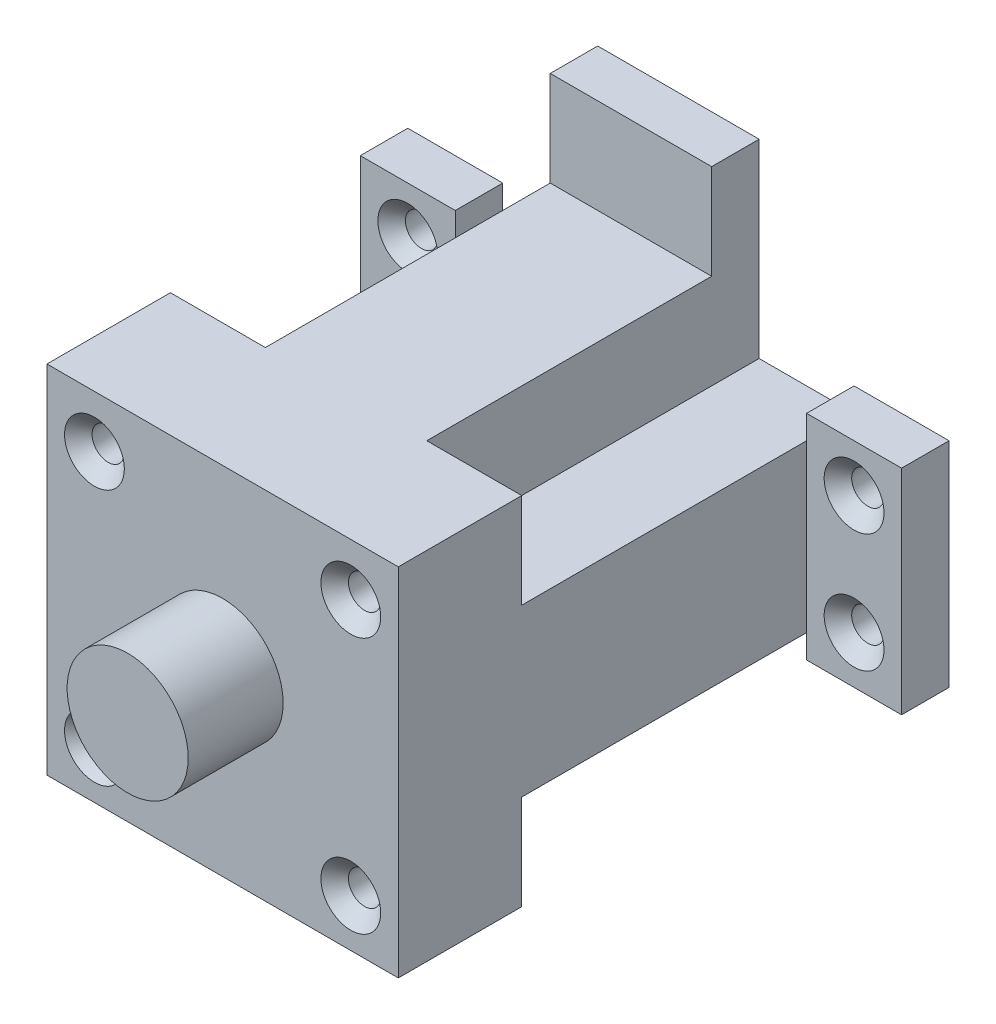
from build123d import *

# Parameters (mm, degrees)
ESQUISSE1_W                                       = 37
ESQUISSE1_H                                       = 37.5
BOSS_EXTRU_1_DEPTH                                = 48
ESQUISSE2_R                                       = 6.375
BOSS_EXTRU_2_DEPTH                                = 10
FRAISAGE_POUR_VIS_T_TE_FRAIS_E_BOMB_E_D           = 3.4
FRAISAGE_POUR_VIS_T_TE_FRAIS_E_BOMB_E_DEPTH       = 48
FRAISAGE_POUR_VIS_T_TE_FRAIS_E_BOMB_E_CSINK_D     = 6.3
FRAISAGE_POUR_VIS_T_TE_FRAIS_E_BOMB_E_CSINK_ANGLE = 90
FRAISAGE_POUR_VIS_T_TE_FRAIS_E_BOMB_E_TIP         = 1.021463052
ESQUISSE10_W                                      = 10
ESQUISSE10_H                                      = 10
ENL_V_MAT_EXTRU_1_DEPTH                           = 35
ESQUISSE11_W                                      = 17
ESQUISSE11_H                                      = 10
ESQUISSE11_W_2                                    = 10
ESQUISSE11_H_2                                    = 22.5
BOSS_EXTRU_5_DEPTH                                = 5
FRAISAGE_POUR_VIS_T_TE_FRAIS_E_BOM_2_D            = 3.4
FRAISAGE_POUR_VIS_T_TE_FRAIS_E_BOM_2_DEPTH        = 5
FRAISAGE_POUR_VIS_T_TE_FRAIS_E_BOM_2_CSINK_D      = 6.3
FRAISAGE_POUR_VIS_T_TE_FRAIS_E_BOM_2_CSINK_ANGLE  = 90
FRAISAGE_POUR_VIS_T_TE_FRAIS_E_BOM_2_TIP          = 1.021463052


with BuildPart() as part:
    # Esquisse1 → Boss.-Extru.1 (new body)
    with BuildSketch(Plane.XY):
        with Locations((18.5, 18.75)):
            Rectangle(ESQUISSE1_W, ESQUISSE1_H)
    extrude(amount=BOSS_EXTRU_1_DEPTH)

    # Esquisse2 → Boss.-Extru.2 (add)
    with BuildSketch(Plane.XY.offset(48)):
        with Locations((18.5, 19)):
            Circle(ESQUISSE2_R)
    extrude(amount=BOSS_EXTRU_2_DEPTH)

    # Fraisage pour vis _ t_te frais_e bomb_e
    with Locations(Plane.XY.offset(48)):
        with Locations((5, 32), (32, 32), (32, 5), (5, 5)):
            CounterSinkHole(FRAISAGE_POUR_VIS_T_TE_FRAIS_E_BOMB_E_D / 2, FRAISAGE_POUR_VIS_T_TE_FRAIS_E_BOMB_E_CSINK_D / 2, depth=FRAISAGE_POUR_VIS_T_TE_FRAIS_E_BOMB_E_DEPTH, counter_sink_angle=FRAISAGE_POUR_VIS_T_TE_FRAIS_E_BOMB_E_CSINK_ANGLE)
            with Locations((0, 0, -(FRAISAGE_POUR_VIS_T_TE_FRAIS_E_BOMB_E_DEPTH + FRAISAGE_POUR_VIS_T_TE_FRAIS_E_BOMB_E_TIP / 2))):  # 118° drill point
                Cone(0, FRAISAGE_POUR_VIS_T_TE_FRAIS_E_BOMB_E_D / 2, FRAISAGE_POUR_VIS_T_TE_FRAIS_E_BOMB_E_TIP, mode=Mode.SUBTRACT)

    # Esquisse10 → Enlèv. mat.-Extru.1 (cut)
    with BuildSketch(Plane(origin=(0, 0, 0), x_dir=(-1, 0, 0), z_dir=(0, 0, -1))):
        with Locations((-32, 5)):
            Rectangle(ESQUISSE10_W, ESQUISSE10_H)
        with Locations((-32, 32.5)):
            Rectangle(ESQUISSE10_W, ESQUISSE10_H)
        with Locations((-5, 32.5)):
            Rectangle(ESQUISSE10_W, ESQUISSE10_H)
        with Locations((-5, 5)):
            Rectangle(ESQUISSE10_W, ESQUISSE10_H)
    extrude(amount=-ENL_V_MAT_EXTRU_1_DEPTH, mode=Mode.SUBTRACT)

    # Esquisse11 → Boss.-Extru.5 (add)
    with BuildSketch(Plane(origin=(0, 0, 0), x_dir=(-1, 0, 0), z_dir=(0, 0, -1))):
        with Locations((-18.5, 42.5)):
            Rectangle(ESQUISSE11_W, ESQUISSE11_H)
        with Locations((-42, 18.75)):
            Rectangle(ESQUISSE11_W_2, ESQUISSE11_H_2)
        with Locations((5, 18.75)):
            Rectangle(ESQUISSE11_W_2, ESQUISSE11_H_2)
    extrude(amount=-BOSS_EXTRU_5_DEPTH)

    # Fraisage pour vis _ t_te frais_e bom 2
    with Locations(Plane.XY.offset(5)):
        with Locations((-5, 12.5), (-5, 25), (42, 25), (42, 12.5)):
            CounterSinkHole(FRAISAGE_POUR_VIS_T_TE_FRAIS_E_BOM_2_D / 2, FRAISAGE_POUR_VIS_T_TE_FRAIS_E_BOM_2_CSINK_D / 2, depth=FRAISAGE_POUR_VIS_T_TE_FRAIS_E_BOM_2_DEPTH, counter_sink_angle=FRAISAGE_POUR_VIS_T_TE_FRAIS_E_BOM_2_CSINK_ANGLE)
            with Locations((0, 0, -(FRAISAGE_POUR_VIS_T_TE_FRAIS_E_BOM_2_DEPTH + FRAISAGE_POUR_VIS_T_TE_FRAIS_E_BOM_2_TIP / 2))):  # 118° drill point
                Cone(0, FRAISAGE_POUR_VIS_T_TE_FRAIS_E_BOM_2_D / 2, FRAISAGE_POUR_VIS_T_TE_FRAIS_E_BOM_2_TIP, mode=Mode.SUBTRACT)


solid = part.part
